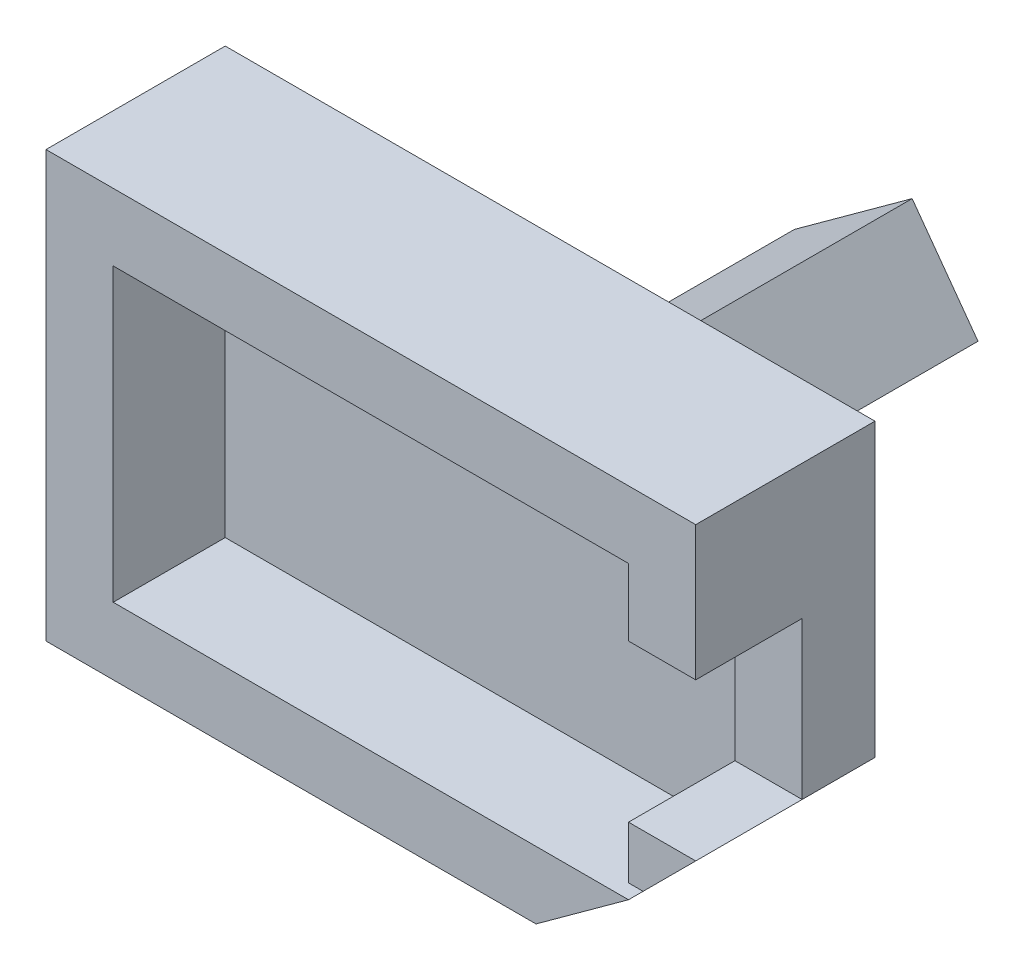
from build123d import *

# Parameters (mm, degrees)
BOSS_EXTRUDE1_DEPTH = 3
BOSS_EXTRUDE2_DEPTH = 5
BOSS_EXTRUDE3_DEPTH = 15
SKETCH4_W           = 4.75
SKETCH4_H           = 7
CUT_EXTRUDE1_DEPTH  = 8


with BuildPart() as part:
    # Sketch1 → Boss-Extrude1 (new body)
    with BuildSketch(Plane.XY):
        Polygon((7.370854239, -9.5), (-14.5, -9.5), (-14.5, 9.5), (14.5, 9.5), (14.5, -3.5), (11.5, -6.5), align=None)
    extrude(amount=BOSS_EXTRUDE1_DEPTH)

    # Sketch2 → Boss-Extrude2 (add)
    with BuildSketch(Plane.XY.offset(3)):
        Polygon((14.5, -3.5), (12.151215505, -5.848784495), (11.5, -5.848784495), (11.5, 6.5), (-11.5, 6.5), (-11.5, -6.5), (11.5, -6.5), (7.370854239, -9.5), (-14.5, -9.5), (-14.5, 9.5), (14.5, 9.5), align=None)
    extrude(amount=BOSS_EXTRUDE2_DEPTH)

    # Sketch3 → Boss-Extrude3 (add)
    with BuildSketch(Plane(origin=(0, 0, 0), x_dir=(-1, 0, 0), z_dir=(0, 0, -1))):
        Polygon((-1.159842101, 3.932844556), (4.098768362, 0.112240416), (1.159842101, -3.932844556), (-4.098768362, -0.112240416), align=None)
    extrude(amount=BOSS_EXTRUDE3_DEPTH)

    # Sketch4 → Cut-Extrude1 (cut)
    with BuildSketch(Plane(origin=(14.5, 0, 0), x_dir=(0, 0, -1), z_dir=(1, 0, 0))):
        with Locations((-5.625, 0)):
            Rectangle(SKETCH4_W, SKETCH4_H)
    extrude(amount=-CUT_EXTRUDE1_DEPTH, mode=Mode.SUBTRACT)


solid = part.part
